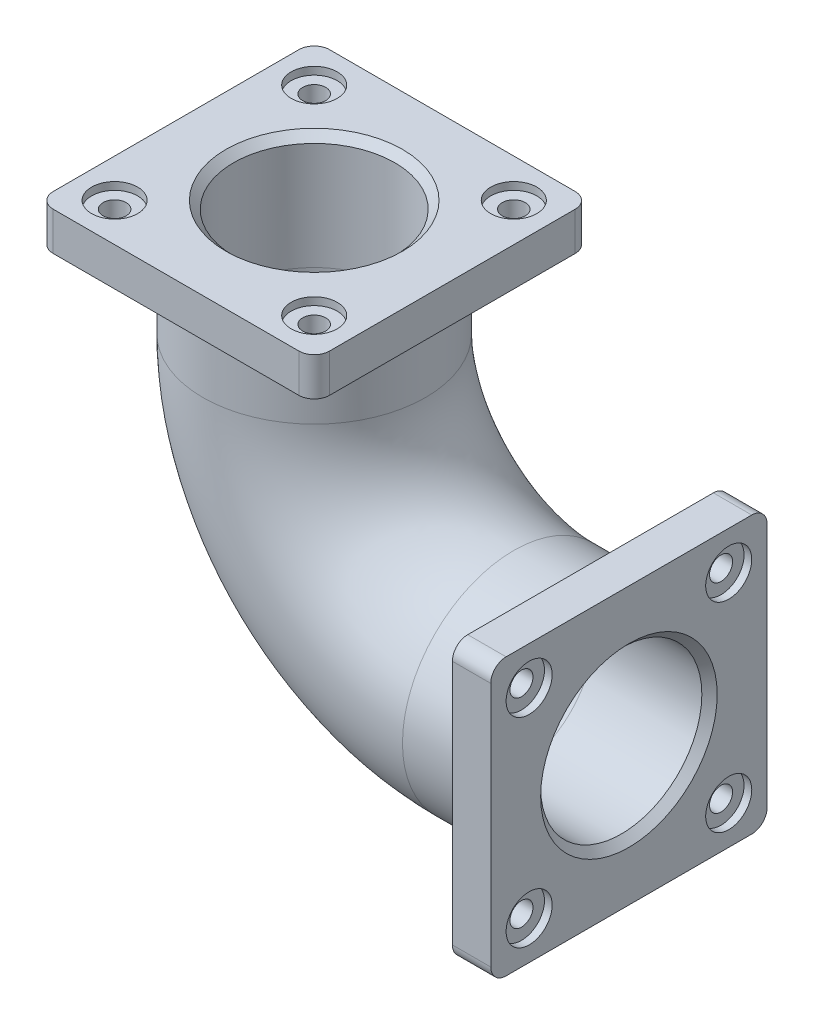
from build123d import *
from build123d.topology import SkipClean

# Parameters (mm, degrees)
BOSS_EXTRUDE1_DEPTH = 50
SKETCH2_R           = 30
CUT_EXTRUDE1_DEPTH  = 10
SKETCH5_R           = 15
CUT_EXTRUDE2_DEPTH  = 258.681974535
SKETCH6_R           = 145
BOSS_EXTRUDE3_DEPTH = 100
SKETCH7_R           = 105
CUT_EXTRUDE3_DEPTH  = 296.465734054
CHAMFER1_SIZE       = 10
SWEEP1_OUTLINE_R    = 145
SWEEP1_OUTLINE_R_2  = 105
SWEEP1_ANGLE        = 45


# Read off the part's stored shape, not the designer's step: Sweep1
with BuildPart() as part:
    # Sketch1 → Boss-Extrude1 (new body)
    with BuildSketch(Plane(origin=(0, 0, 0), x_dir=(0, 0, -1), z_dir=(1, 0, 0))):
        with BuildLine():
            Line((-160, 180), (160, 180))
            ThreePointArc((160, 180), (174.142135624, 174.142135624), (180, 160))
            Line((180, 160), (180, -160))
            ThreePointArc((180, -160), (174.142135624, -174.142135624), (160, -180))
            Line((160, -180), (-160, -180))
            ThreePointArc((-160, -180), (-174.142135624, -174.142135624), (-180, -160))
            Line((-180, -160), (-180, 160))
            ThreePointArc((-180, 160), (-174.142135624, 174.142135624), (-160, 180))
        make_face()
    extrude(amount=-BOSS_EXTRUDE1_DEPTH)

    # Sketch2 → Cut-Extrude1 (cut)
    with BuildSketch(Plane(origin=(0, 0, 0), x_dir=(0, 0, -1), z_dir=(1, 0, 0))):
        with Locations((-130, 130)):
            Circle(SKETCH2_R)
        with Locations((130, 130)):
            Circle(SKETCH2_R)
        with Locations((130, -130)):
            Circle(SKETCH2_R)
        with Locations((-130, -130)):
            Circle(SKETCH2_R)
    extrude(amount=-CUT_EXTRUDE1_DEPTH, mode=Mode.SUBTRACT)

    # Sketch5 → Cut-Extrude2 (cut, through all)
    with BuildSketch(Plane(origin=(-10, 0, 0), x_dir=(0, 0, -1), z_dir=(1, 0, 0))):
        with Locations((-130, 130)):
            Circle(SKETCH5_R)
        with Locations((130, 130)):
            Circle(SKETCH5_R)
        with Locations((130, -130)):
            Circle(SKETCH5_R)
        with Locations((-130, -130)):
            Circle(SKETCH5_R)
    extrude(amount=-CUT_EXTRUDE2_DEPTH, mode=Mode.SUBTRACT)

    # Sketch6 → Boss-Extrude3 (add)
    with BuildSketch(Plane.ZY.offset(50)):
        with Locations(Location((0, 0, 0), (0, 0, 180))):
            Circle(SKETCH6_R)
    extrude(amount=BOSS_EXTRUDE3_DEPTH)

    # Sketch7 → Cut-Extrude3 (cut, through all)
    with BuildSketch(Plane(origin=(0, 0, 0), x_dir=(0, 0, -1), z_dir=(1, 0, 0))):
        Circle(SKETCH7_R)
    extrude(amount=-CUT_EXTRUDE3_DEPTH, mode=Mode.SUBTRACT)

    # Chamfer1
    chamfer1_edges = [part.edges().sort_by_distance(p)[0] for p in [
        (0, 0, 105),
    ]]
    chamfer(chamfer1_edges, length=CHAMFER1_SIZE)

    # Sweep1 outline → Sweep1 (revolve)
    with BuildSketch(Plane(origin=(-150, 260, 0), x_dir=(-0.707106781186543, -0.707106781186552, 0), z_dir=(-0.707106781186552, 0.707106781186543, 0))):
        with Locations((260, 0)):
            Circle(SWEEP1_OUTLINE_R)
        with Locations((260, 0)):
            Circle(SWEEP1_OUTLINE_R_2, mode=Mode.SUBTRACT)
    revolve(axis=Axis((-150, 260, 0), (0, 0, 1)), revolution_arc=SWEEP1_ANGLE)

    # Mirror3: part across plane


with BuildPart() as part_1:
    with SkipClean():  # the faces are left unmerged after this step: merging them gives an invalid solid
        add(part.part)
        add(part.part.mirror(Plane(origin=(-333.847763109, 76.152236891, 0), x_dir=(0, 0, 1), z_dir=(-0.7071067811865515, 0.7071067811865437, 0))))


solid = part_1.part
